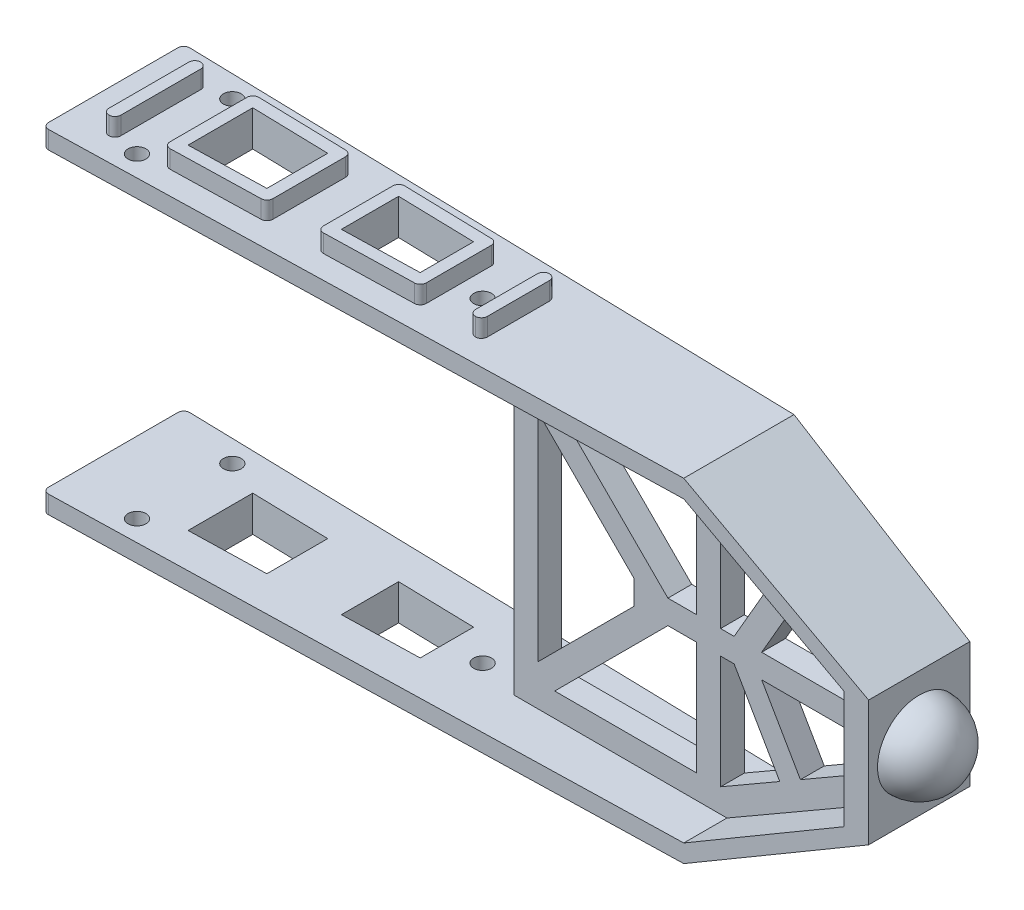
from build123d import *
from build123d.topology import SkipClean

# Parameters (mm, degrees)
EXTRUDE_1_DEPTH     = 3
SKETCH_2_R          = 1.5
CUT_EXTRUDE_1_DEPTH = 3
EXTRUDE_2_DEPTH     = 3
FILLET_1_R          = 1
FILLET_2_R          = 1
CUT_EXTRUDE_2_DEPTH = 3
EXTRUDE_START       = -17.477520588
EXTRUDE_3_DEPTH     = 20.477520588
EXTRUDE_START_2     = -11.853392215
EXTRUDE_3_2_DEPTH   = 23.70678443
EXTRUDE_4_REACH     = 165.663
SKETCH_6_W          = 66
SKETCH_6_H          = 4
EXTRUDE_6_REACH     = 172.329
EXTRUDE_7_REACH     = 172.329
CUT_EXTRUDE_3_DEPTH = 4


with BuildPart() as part:
    # 草图1 → 凸台-拉伸1 (new body)
    with BuildSketch(Plane(origin=(0, 0, 0), x_dir=(1, 0, 0), z_dir=(0, 1, 0))):
        Polygon((25, 11.878712678), (25, -11.878712678), (130, -9.252891981), (130, 9.252891981), align=None)
    extrude(amount=EXTRUDE_1_DEPTH)

    # 草图2 → 切除-拉伸1 (cut)
    with BuildSketch(Plane(origin=(0, 3, 0), x_dir=(1, 0, 0), z_dir=(0, 1, 0))):
        with Locations(Location((37, 8, 0), (0, 0, 270))):
            Circle(SKETCH_2_R)
        with Locations(Location((37, -8, 0), (0, 0, 270))):
            Circle(SKETCH_2_R)
        with Locations(Location((87, 0, 0), (0, 0, 270))):
            Circle(SKETCH_2_R)
    extrude(amount=-CUT_EXTRUDE_1_DEPTH, mode=Mode.SUBTRACT)

    # 草图3 → 凸台-拉伸2 (add)
    with BuildSketch(Plane(origin=(0, 3, 0), x_dir=(1, 0, 0), z_dir=(0, 1, 0))):
        Polygon((33, 5.676774269), (33, 7.677399562), (31, 7.727415195), (31, 5.726789902), align=None)
        Polygon((33, 0), (33, 5.676774269), (31, 5.726789902), (31, 0), align=None)
        Polygon((33, -5.676774269), (33, 0), (31, 0), (31, -5.726789902), align=None)
        Polygon((33, -7.677399562), (33, -5.676774269), (31, -5.726789902), (31, -7.727415195), align=None)
        Polygon((43, 7.427321401), (41, 7.477337033), (41, 5.47671174), (43, 5.426696108), align=None)
        Polygon((43, 5.426696108), (41, 5.47671174), (41, 0), (43, 0), align=None)
        Polygon((43, 0), (41, 0), (41, -5.47671174), (43, -5.426696108), align=None)
        Polygon((43, -5.426696108), (41, -5.47671174), (41, -7.477337033), (43, -7.427321401), align=None)
        Polygon((55.9, 7.104720572), (43, 7.427321401), (43, 5.426696108), (55.9, 5.104095279), align=None)
        Polygon((55.9, -5.104095279), (43, -5.426696108), (43, -7.427321401), (55.9, -7.104720572), align=None)
        Polygon((57.9, 7.05470494), (55.9, 7.104720572), (55.9, 5.104095279), (57.9, 5.054079647), align=None)
        Polygon((57.9, 5.054079647), (55.9, 5.104095279), (55.9, 0), (57.9, 0), align=None)
        Polygon((57.9, 0), (55.9, 0), (55.9, -5.104095279), (57.9, -5.054079647), align=None)
        Polygon((57.9, -5.054079647), (55.9, -5.104095279), (55.9, -7.104720572), (57.9, -7.05470494), align=None)
        Polygon((68.1, 6.799625215), (66.1, 6.849640847), (66.1, 4.849015554), (68.1, 4.798999922), align=None)
        Polygon((68.1, 4.798999922), (66.1, 4.849015554), (66.1, 0), (68.1, 0), align=None)
        Polygon((68.1, 0), (66.1, 0), (66.1, -4.849015554), (68.1, -4.798999922), align=None)
        Polygon((68.1, -4.798999922), (66.1, -4.849015554), (66.1, -6.849640847), (68.1, -6.799625215), align=None)
        Polygon((81, 6.477024386), (68.1, 6.799625215), (68.1, 4.798999922), (81, 4.476399093), align=None)
        Polygon((81, -4.476399093), (68.1, -4.798999922), (68.1, -6.799625215), (81, -6.477024386), align=None)
        Polygon((83, -4.426383461), (81, -4.476399093), (81, -6.477024386), (83, -6.427008754), align=None)
        Polygon((83, 0), (81, 0), (81, -4.476399093), (83, -4.426383461), align=None)
        Polygon((83, 4.426383461), (81, 4.476399093), (81, 0), (83, 0), align=None)
        Polygon((83, 6.427008754), (81, 6.477024386), (81, 4.476399093), (83, 4.426383461), align=None)
        Polygon((93, 6.176930593), (91, 6.226946225), (91, 4.226320932), (93, 4.176305299), align=None)
        Polygon((93, 4.176305299), (91, 4.226320932), (91, 0), (93, 0), align=None)
        Polygon((93, 0), (91, 0), (91, -4.226320932), (93, -4.176305299), align=None)
        Polygon((93, -4.176305299), (91, -4.226320932), (91, -6.226946225), (93, -6.176930593), align=None)
    extrude(amount=EXTRUDE_2_DEPTH)

    # 圆角1
    fillet_1_edges = [part.edges().sort_by_distance(p)[0] for p in [
        (91, 4.5, -6.226946225),
        (91, 4.5, 6.226946225),
        (93, 4.5, 6.176930593),
        (93, 4.5, -6.176930593),
        (31, 4.5, -7.727415195),
        (31, 4.5, 7.727415195),
        (33, 4.5, 7.677399562),
        (33, 4.5, -7.677399562),
        (41, 4.5, 7.477337033),
        (57.9, 4.5, 7.05470494),
        (57.9, 4.5, -7.05470494),
        (41, 4.5, -7.477337033),
        (66.1, 4.5, 6.849640847),
        (83, 4.5, 6.427008754),
        (83, 4.5, -6.427008754),
        (66.1, 4.5, -6.849640847),
    ]]
    fillet(fillet_1_edges, radius=FILLET_1_R - 0.0001)  # a hair under: the kernel refuses the full size

    # 圆角2
    fillet_2_edges = [part.edges().sort_by_distance(p)[0] for p in [
        (25, 1.5, 11.878712678),
        (25, 1.5, -11.878712678),
    ]]
    fillet(fillet_2_edges, radius=FILLET_2_R)

    # 草图4 → 切除-拉伸2 (cut)
    with BuildSketch(Plane(origin=(0, 3, 0), x_dir=(1, 0, 0), z_dir=(0, 1, 0))):
        Polygon((43, 5.426696108), (55.9, 5.104095279), (55.9, -5.104095279), (43, -5.426696108), align=None)
        Polygon((68.1, 4.798999922), (81, 4.476399093), (81, -4.476399093), (68.1, -4.798999922), align=None)
    extrude(amount=-CUT_EXTRUDE_2_DEPTH, mode=Mode.SUBTRACT)

    # 凸台-拉伸3: read off the stored shape, not the designer's step
    # 凸台-拉伸3 outline → 凸台-拉伸3 (add)
    with BuildSketch(Plane(origin=(0, 0, 0), x_dir=(1, 0, 0), z_dir=(0, 1, 0)).offset(EXTRUDE_START)):
        Polygon((130, -9.25289198), (160.262492185, -8.496093139), (160.262492185, 8.496093139), (130, 9.25289198), align=None)
    extrude(amount=EXTRUDE_3_DEPTH)

    # Extrude 3 2 outline → Extrude 3 2 (cut)
    with BuildSketch(Plane.XY.offset(EXTRUDE_START_2)):
        Polygon((130, 3), (160.262492185, -14.477520588), (160.262492185, 3), align=None)
        Polygon((160.262492185, -17.477520588), (130, 0), (130, -17.477520588), align=None)
    extrude(amount=EXTRUDE_3_2_DEPTH, mode=Mode.SUBTRACT)

    # 草图6 → 凸台-拉伸4 (add, up to next)
    with BuildSketch(Plane(origin=(0, -25, 0), x_dir=(-1, 0, 0), z_dir=(0, -1, 0)), mode=Mode.PRIVATE) as extrude_4_sk1:
        with Locations((-127.262492185, 0)):
            Rectangle(SKETCH_6_W, SKETCH_6_H)
    extrude_4_tool1 = extrude(extrude_4_sk1.sketch, amount=-EXTRUDE_4_REACH, mode=Mode.PRIVATE) - part.part
    add(extrude_4_tool1.solids().sort_by_distance((127.262492, -25, 0))[0])

    # 镜向21: part across plane


with BuildPart() as part_1:
    add(part.part)
    add(part.part.mirror(Plane(origin=(0, -25, 0), x_dir=(0, 0, 1), z_dir=(0, -1, 0))))

    # 凸台-拉伸6: up to this plane
    extrude_6_end = Plane(origin=(0.3125, 3, -12.496093139), z_dir=(0.024999999999999984, 0, -0.9996874511566103))
    # 草图8 → 凸台-拉伸6 (add, up to the surface)
    with BuildSketch(Plane(origin=(0, 0, -2), x_dir=(-1, 0, 0), z_dir=(0, 0, -1)), mode=Mode.PRIVATE) as extrude_6_sk1:
        Polygon((-160.262492185, -17.477520588), (-160.262492185, -32.522479412), (-156.262492185, -34.832602515), (-156.262492185, -15.167397485), align=None)
    extrude_6_tool1 = split(extrude(extrude_6_sk1.sketch, amount=EXTRUDE_6_REACH, mode=Mode.PRIVATE), bisect_by=extrude_6_end, keep=Keep.BOTH, mode=Mode.PRIVATE)
    add(extrude_6_tool1.solids().sort_by_distance((158.173753, -25, -2))[0])

    # 凸台-拉伸7: up to this plane
    extrude_7_end = Plane(origin=(0.3125, 3, 12.496093139), z_dir=(-0.024999999999999984, 0, -0.9996874511566103))
    # 草图9 → 凸台-拉伸7 (add, up to the surface)
    with BuildSketch(Plane.XY.offset(2), mode=Mode.PRIVATE) as extrude_7_sk1:
        Polygon((160.262492185, -17.477520588), (156.262492185, -15.167397485), (156.262492185, -34.832602515), (160.262492185, -32.522479412), align=None)
    extrude_7_tool1 = split(extrude(extrude_7_sk1.sketch, amount=EXTRUDE_7_REACH, mode=Mode.PRIVATE), bisect_by=extrude_7_end, keep=Keep.BOTH, mode=Mode.PRIVATE)
    add(extrude_7_tool1.solids().sort_by_distance((158.173753, -25, 2))[0])

    # 草图10 → 切除-拉伸3 (cut)
    with BuildSketch(Plane(origin=(0, 0, -2), x_dir=(-1, 0, 0), z_dir=(0, 0, -1))):
        Polygon((-142.327118039, -11.738453253), (-152.262492185, -17.476437591), (-152.262492185, -23), (-135.82322821, -23), align=None)
        Polygon((-135.82322821, -27), (-152.262492185, -27), (-152.262492185, -32.523562409), (-142.327118039, -38.261546747), align=None)
        Polygon((-128.927913048, -4), (-138.863287194, -9.737984338), (-131.204065001, -23), (-128.927913048, -23), align=None)
        Polygon((-128.927913048, -27), (-131.204065001, -27), (-138.863287194, -40.262015662), (-128.927913048, -46), align=None)
        Polygon((-101.09091931, -4), (-124.927913048, -4), (-124.927913048, -23), (-120.09091931, -23), align=None)
        Polygon((-120.09091931, -27), (-124.927913048, -27), (-124.927913048, -46), (-101.09091931, -46), align=None)
        Polygon((-98.262492185, -6.828427125), (-114.43406506, -23), (-114.43406506, -27), (-98.262492185, -43.171572875), align=None)
    extrude(amount=-CUT_EXTRUDE_3_DEPTH, mode=Mode.SUBTRACT)

    # 草图11 → 旋转1 (revolve)
    with SkipClean():  # the faces are left unmerged after this step: merging them gives an invalid solid
        with BuildSketch(Plane.XY, mode=Mode.PRIVATE) as revolve_1_sk:
            with BuildLine():
                Line((160.262492185, -25), (160.262492185, -32))
                ThreePointArc((160.262492185, -32), (165.212239653, -29.949747468), (167.262492185, -25))
                Line((167.262492185, -25), (160.262492185, -25))
            make_face()
            with BuildLine():
                Line((160.262492185, -18), (160.262492185, -25))
                Line((160.262492185, -25), (167.262492185, -25))
                ThreePointArc((167.262492185, -25), (165.212239653, -20.050252532), (160.262492185, -18))
            make_face()
        revolve(revolve_1_sk.sketch.rotate(Axis((160.262492185, -25, 0), (1, 0, 0)), 180), axis=Axis((160.262492185, -25, 0), (1, 0, 0)))
    add(part_1.part.scale(1), mode=Mode.REPLACE)  # the faces are merged on a copy


solid = part_1.part
